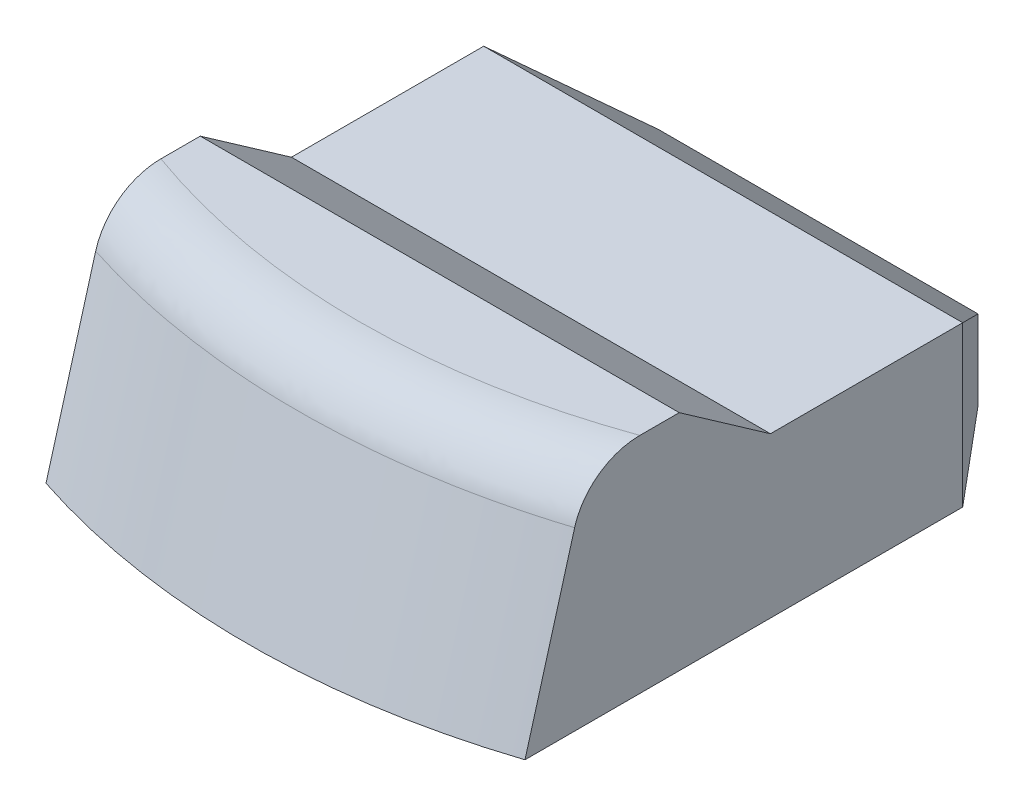
from build123d import *

# Parameters (mm, degrees)
SKETCH_1_W          = 3
SKETCH_1_H          = 3.8
EXTRUDE_1_DEPTH     = 1
SKETCH_2_W          = 3
SKETCH_2_H          = 2
EXTRUDE_2_DEPTH     = 1
CHAMFER_1_SIZE      = 0.5
CHAMFER_1_SIZE2     = 0.595876796
CHAMFER_3_SIZE      = 1
CHAMFER_3_SIZE_2    = 1.428148007
CUT_EXTRUDE_1_DEPTH = 3.4
CUT_EXTRUDE_START   = 0.4
SKETCH_7_W          = 5.415057917
SKETCH_7_H          = 3.835149715
CUT_EXTRUDE_2_DEPTH = 3.4
FILLET_1_R          = 0.4


with BuildPart() as part:
    # 草图1 → 凸台-拉伸1 (new body)
    with BuildSketch(Plane(origin=(0, 0, 0), x_dir=(1, 0, 0), z_dir=(0, 1, 0))):
        with Locations((0, -0.9)):
            Rectangle(SKETCH_1_W, SKETCH_1_H)
    extrude(amount=EXTRUDE_1_DEPTH)

    # 草图2 → 凸台-拉伸2 (add)
    with BuildSketch(Plane(origin=(0, 1, 0), x_dir=(1, 0, 0), z_dir=(0, 1, 0))):
        with Locations((0, -1.8)):
            Rectangle(SKETCH_2_W, SKETCH_2_H)
    extrude(amount=EXTRUDE_2_DEPTH)

    # 倒角1
    chamfer_1_edges = [part.edges().sort_by_distance(p)[0] for p in [
        (0, 1, -1),
        (-1.5, 0.5, -1),
        (1.5, 0.5, -1),
    ]]
    chamfer_1_side = [part.faces().sort_by_distance(p)[0] for p in [
        (0, 0.5, -1),
    ]]
    chamfer(chamfer_1_edges, length=CHAMFER_1_SIZE, length2=CHAMFER_1_SIZE2, reference=chamfer_1_side[0])

    # 倒角3
    # the kernel refuses this chamfer: 1.428148007, 1 mm, written as the material it takes off along each edge
    with BuildSketch(Plane(origin=(5.18826682, 2, 0.8), x_dir=(0, -0.9989750717851554, -0.04526373771402124), z_dir=(-1, 0, 0))) as chamfer_3_piece_1_section:
        Polygon((CHAMFER_3_SIZE * 0.998975071785, CHAMFER_3_SIZE * 0.045263737714), (-CHAMFER_3_SIZE_2 * 0.0452637377058, CHAMFER_3_SIZE_2 * 0.998975071605), (0, 0), align=None)
    chamfer_3_piece_1 = extrude(amount=10.37653364, mode=Mode.PRIVATE)
    chamfer_3_piece_1 = split(chamfer_3_piece_1, bisect_by=Plane(origin=(0, 1, 1.276872226), z_dir=(0, 1, 0)), keep=Keep.TOP, mode=Mode.PRIVATE)
    add(chamfer_3_piece_1, mode=Mode.SUBTRACT)

    # 草图4 → 切除-拉伸1 (cut, along a direction that is not the sketch's normal)
    with BuildSketch(Plane.XZ):
        with BuildLine():
            Line((1.59999292, 2.303360359), (2.090500244, 2.793867684))
            Line((2.090500244, 2.793867684), (1.735885254, 4.087234068))
            Line((1.735885254, 4.087234068), (1.71936645, 4.089830446))
            Line((1.71936645, 4.089830446), (-1.672891968, 4.089830446))
            Line((-1.672891968, 4.089830446), (-1.91054636, 3.486179043))
            Line((-1.91054636, 3.486179043), (-2.191031794, 2.570257584))
            Line((-2.191031794, 2.570257584), (-1.60000708, 2.303360359))
            ThreePointArc((-1.60000708, 2.303360359), (-7.08e-06, 2.577223661), (1.59999292, 2.303360359))
        make_face()
    extrude(amount=-CUT_EXTRUDE_1_DEPTH, dir=(0, -0.9625068420560824, 0.27125740357680156), mode=Mode.SUBTRACT)

    # 草图7 → 切除-拉伸2 (cut)
    with BuildSketch(Plane(origin=(0, 1, 0), x_dir=(1, 0, 0), z_dir=(0, 1, 0)).offset(CUT_EXTRUDE_START)):
        with Locations((0.008843871, -1.614836942)):
            Rectangle(SKETCH_7_W, SKETCH_7_H)
    extrude(amount=CUT_EXTRUDE_2_DEPTH, mode=Mode.SUBTRACT)

    # 圆角1
    fillet_1_edges = [part.edges().sort_by_distance(p)[0] for p in [
        (3.79e-07, 1.4, 2.182670242),
    ]]
    fillet(fillet_1_edges, radius=FILLET_1_R)


solid = part.part
